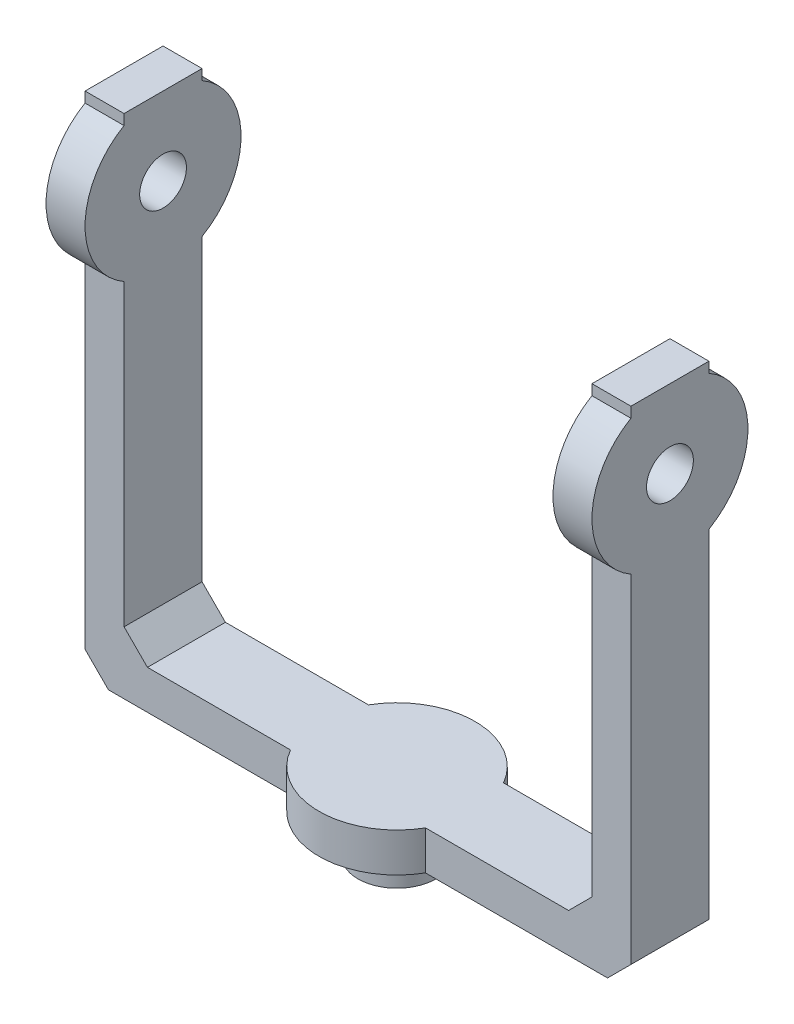
from build123d import *

# Parameters (mm, degrees)
SKETCH1_R           = 250
BOSS_EXTRUDE1_DEPTH = 250
BOSS_EXTRUDE2_DEPTH = 250
SKETCH4_W           = 250
SKETCH4_H           = 500
BOSS_EXTRUDE3_DEPTH = 3250
SKETCH7_R           = 500
BOSS_EXTRUDE4_DEPTH = 250
SKETCH8_R           = 150
CUT_EXTRUDE1_DEPTH  = 250
CHAMFER1_SIZE       = 150


with BuildPart() as part:
    # Sketch1 → Boss-Extrude1 (new body)
    with BuildSketch(Plane(origin=(0, 0, 0), x_dir=(1, 0, 0), z_dir=(0, 1, 0))):
        Circle(SKETCH1_R)
    extrude(amount=BOSS_EXTRUDE1_DEPTH)

    # Sketch2 → Boss-Extrude2 (add)
    with BuildSketch(Plane(origin=(0, 250, 0), x_dir=(1, 0, 0), z_dir=(0, 1, 0))):
        with BuildLine():
            Line((-433.012701892, 250), (-1500, 250))
            Line((-1500, 250), (-1500, -250))
            Line((-1500, -250), (-433.012701892, -250))
            ThreePointArc((-433.012701892, -250), (0, -500), (433.012701892, -250))
            Line((433.012701892, -250), (1500, -250))
            Line((1500, -250), (1500, 250))
            Line((1500, 250), (433.012701892, 250))
            ThreePointArc((433.012701892, 250), (0, 500), (-433.012701892, 250))
        make_face()
    extrude(amount=BOSS_EXTRUDE2_DEPTH)

    # Sketch4 → Boss-Extrude3 (add)
    with BuildSketch(Plane(origin=(0, 250, 0), x_dir=(1, 0, 0), z_dir=(0, 1, 0))):
        with Locations((1625, 0)):
            Rectangle(SKETCH4_W, SKETCH4_H)
    boss_extrude3 = extrude(amount=BOSS_EXTRUDE3_DEPTH)

    # Sketch7 → Boss-Extrude4 (add)
    with BuildSketch(Plane.ZY.offset(-1500)):
        with Locations((0, 3000)):
            Circle(SKETCH7_R)
    boss_extrude4 = extrude(amount=-BOSS_EXTRUDE4_DEPTH)

    # Sketch8 → Cut-Extrude1 (cut)
    with BuildSketch(Plane.ZY.offset(-1500)):
        with Locations((0, 3000)):
            Circle(SKETCH8_R)
    cut_extrude1 = extrude(amount=-CUT_EXTRUDE1_DEPTH, mode=Mode.SUBTRACT)

    # Mirror1: Boss-Extrude3, Boss-Extrude4, Cut-Extrude1 across plane
    add(boss_extrude3.mirror(Plane(origin=(0, 0, 0), x_dir=(0, 0, 1), z_dir=(1, 0, 0))))
    add(boss_extrude4.mirror(Plane(origin=(0, 0, 0), x_dir=(0, 0, 1), z_dir=(1, 0, 0))))
    add(cut_extrude1.mirror(Plane(origin=(0, 0, 0), x_dir=(0, 0, 1), z_dir=(1, 0, 0))), mode=Mode.SUBTRACT)

    # Chamfer1
    chamfer1_edges = [part.edges().sort_by_distance(p)[0] for p in [
        (1750, 250, 0),
        (1500, 500, 0),
        (-1750, 250, 0),
        (-1500, 500, 0),
    ]]
    chamfer(chamfer1_edges, length=CHAMFER1_SIZE)


solid = part.part
